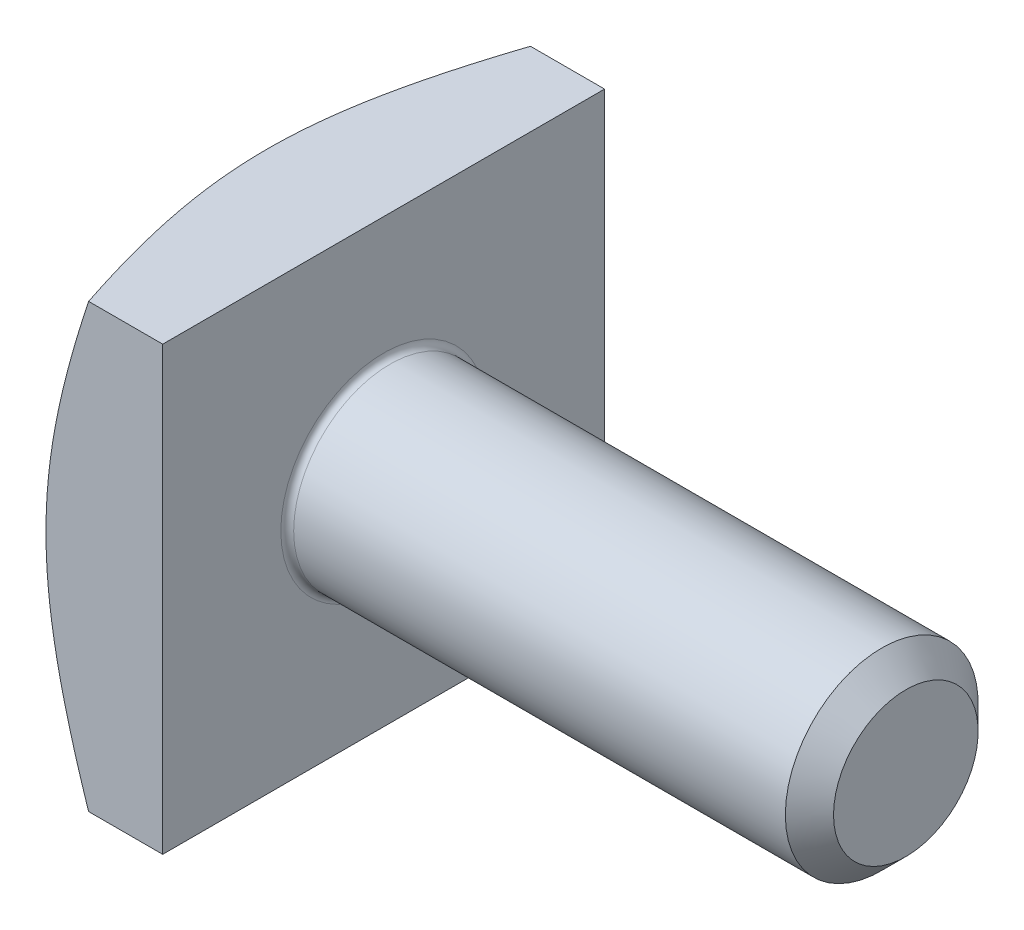
from build123d import *

# Parameters (mm, degrees)
BASEHEADSKE_W  = 55
BASEHEADSKE_H  = 55
BASEHEAD_DEPTH = 15
BODYSKE_W      = 80
BODYSKE_H      = 12
FILLET_2_R     = 0.8


with BuildPart() as part:
    # BaseHeadSke → BaseHead (new body)
    with BuildSketch(Plane(origin=(0, 0, 0), x_dir=(0, 0, -1), z_dir=(1, 0, 0))):
        Rectangle(BASEHEADSKE_W, BASEHEADSKE_H)
    extrude(amount=BASEHEAD_DEPTH)

    # BodySke → BaseBody (revolve)
    with BuildSketch(Plane.XY):
        with Locations((40, 6)):
            Rectangle(BODYSKE_W, BODYSKE_H)
    revolve(axis=Axis((0, 0, 0), (1, 0, 0)))

    # ChamferEndSke → ChamferEnd (revolve, cut)
    with BuildSketch(Plane(origin=(0, 0, 0), x_dir=(1, 0, 0), z_dir=(0, 1, 0))):
        Polygon((77, -12), (80, -9), (80, -12), align=None)
    revolve(axis=Axis((0, 0, 0), (1, 0, 0)), mode=Mode.SUBTRACT)

    # HeadChamferSke → HeadChamfer (revolve, cut)
    with BuildSketch(Plane.XY):
        Polygon((15, 58.667603808), (0, 58.667603808), (0, 26.5), align=None)
    revolve(axis=Axis((0, 0, 0), (1, 0, 0)), mode=Mode.SUBTRACT)

    # Fillet 2
    fillet_2_edges = [part.edges().sort_by_distance(p)[0] for p in [
        (15, -12, 0),
    ]]
    fillet(fillet_2_edges, radius=FILLET_2_R)


solid = part.part
